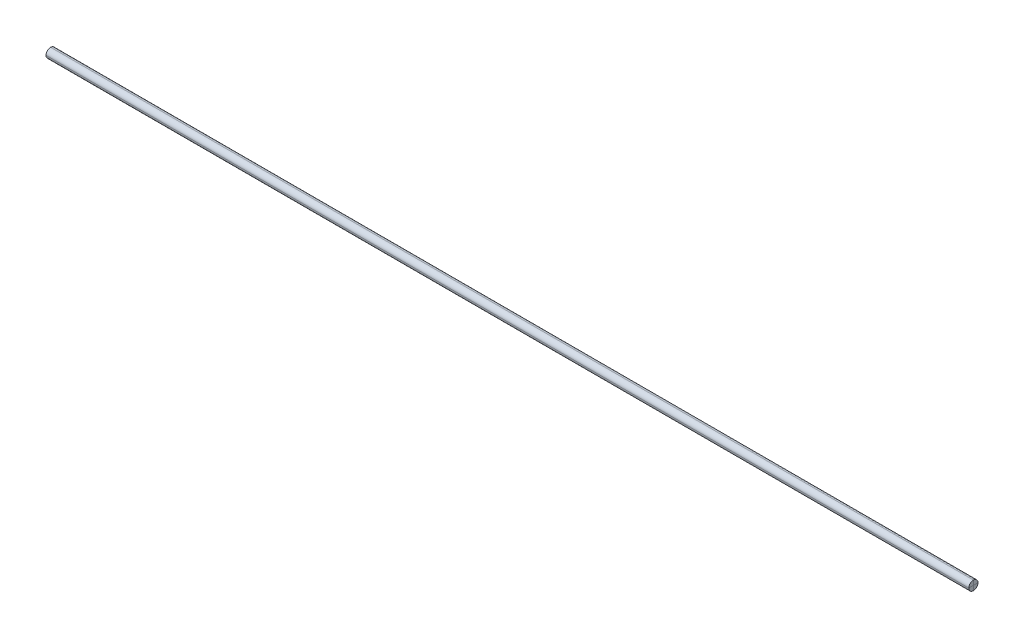
from build123d import *

# Parameters (mm, degrees)
SKETCH_1_R                 = 5
EXTRUDE_1_DEPTH            = 1000
SPLIT_START                = -5.0000001
SPLIT_BODIES_1_OUTLINE_W   = 1000
SPLIT_BODIES_1_OUTLINE_H   = 6
SPLIT_BODIES_1_DEPTH       = 10.0000001
SPLIT_BODIES_1_2_OUTLINE_W = 1000
SPLIT_BODIES_1_2_OUTLINE_H = 6
SPLIT_BODIES_1_2_DEPTH     = 5
SPLIT_BODIES_1_3_DEPTH     = 1000
SPLIT_BODIES_1_4_DEPTH     = 1000
SPLIT_BODIES_1_5_DEPTH     = 1000


# Read off the part's stored shape, not the designer's step: Разделить1
with BuildPart() as part:
    # Эскиз1 → Бобышка-Вытянуть1 (new body)
    with BuildSketch(Plane(origin=(0, 0, 0), x_dir=(0, 0, -1), z_dir=(1, 0, 0))):
        Circle(SKETCH_1_R)
    extrude(amount=EXTRUDE_1_DEPTH)

    # Split Bodies 1 outline → Split Bodies 1 (cut)
    with BuildSketch(Plane(origin=(0, 0, 0), x_dir=(1, 0, 0), z_dir=(0, 1, 0)).offset(SPLIT_START)):
        with Locations((500, -3)):
            Rectangle(SPLIT_BODIES_1_OUTLINE_W, SPLIT_BODIES_1_OUTLINE_H)
    extrude(amount=SPLIT_BODIES_1_DEPTH, mode=Mode.SUBTRACT)

    # Split Bodies 1 2 outline → Split Bodies 1 2 (cut)
    with BuildSketch(Plane(origin=(0, 0, 0), x_dir=(1, 0, 0), z_dir=(0, 1, 0))):
        with Locations((500, 3)):
            Rectangle(SPLIT_BODIES_1_2_OUTLINE_W, SPLIT_BODIES_1_2_OUTLINE_H)
    extrude(amount=SPLIT_BODIES_1_2_DEPTH, mode=Mode.SUBTRACT)


with BuildPart() as body_2:
    # Split Bodies 1 3 outline → Split Bodies 1 3 (new body)
    with BuildSketch(Plane.YZ):
        with BuildLine():
            Line((0, 5), (0, 0))
            Line((0, 0), (5, 0))
            ThreePointArc((5, 0), (3.535533906, 3.535533906), (0, 5))
        make_face()
    extrude(amount=SPLIT_BODIES_1_3_DEPTH)


with BuildPart() as body_3:
    # Split Bodies 1 4 outline → Split Bodies 1 4 (new body)
    with BuildSketch(Plane.YZ):
        with BuildLine():
            Line((-5, 0), (0, 0))
            Line((0, 0), (0, 5))
            ThreePointArc((0, 5), (-3.535533906, 3.535533906), (-5, 0))
        make_face()
    extrude(amount=SPLIT_BODIES_1_4_DEPTH)


with BuildPart() as body_4:
    # Split Bodies 1 5 outline → Split Bodies 1 5 (new body)
    with BuildSketch(Plane.YZ):
        with BuildLine():
            Line((0, 0), (0, -5))
            ThreePointArc((0, -5), (3.535533906, -3.535533906), (5, 0))
            Line((5, 0), (0, 0))
        make_face()
    extrude(amount=SPLIT_BODIES_1_5_DEPTH)


solid = Compound([part.part, body_2.part, body_3.part, body_4.part])
